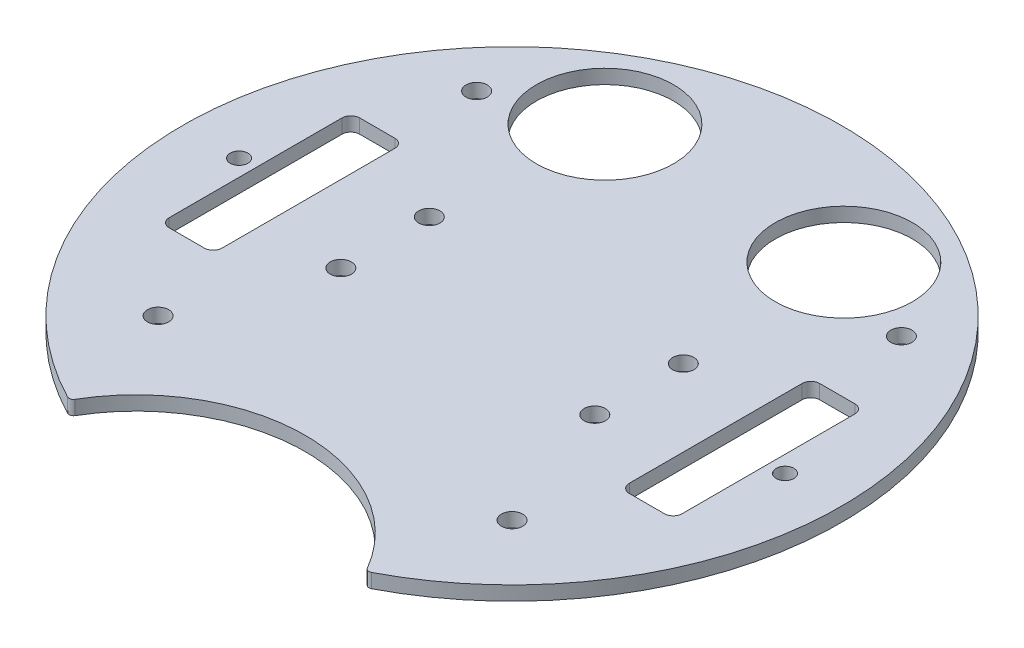
from build123d import *

# Parameters (mm, degrees)
BOSS_EXTRUDE1_DEPTH = 3.2
SKETCH2_W           = 10.76
SKETCH2_H           = 41.868700306
CUT_EXTRUDE1_DEPTH  = 106.40749499
SKETCH3_R           = 2
SKETCH3_R_2         = 2.4
CUT_EXTRUDE2_DEPTH  = 106.40749499
SKETCH4_R           = 15
CUT_EXTRUDE3_DEPTH  = 106.40749499
CUT_EXTRUDE4_DEPTH  = 106.40749499
SKETCH6_R           = 2.4
CUT_EXTRUDE5_DEPTH  = 106.40749499
SKETCH8_R           = 15.5
CUT_EXTRUDE6_DEPTH  = 106.40749499


with BuildPart() as part:
    # Sketch1 → Boss-Extrude1 (new body)
    with BuildSketch(Plane(origin=(0, 0, 0), x_dir=(1, 0, 0), z_dir=(0, 1, 0))):
        with BuildLine():
            ThreePointArc((34.36030176, -66.103098739), (0, 74.5), (-34.36030176, -66.103098739))
            ThreePointArc((-34.36030176, -66.103098739), (-33.621222066, -66.176428208), (-33.035418582, -65.71986465))
            ThreePointArc((-33.035418582, -65.71986465), (0, -46.75), (33.035418582, -65.71986465))
            ThreePointArc((33.035418582, -65.71986465), (33.621222066, -66.176428208), (34.36030176, -66.103098739))
        make_face()
    extrude(amount=BOSS_EXTRUDE1_DEPTH)

    # Sketch2 → Cut-Extrude1 (cut, through all)
    with BuildSketch(Plane(origin=(0, 3.2, 0), x_dir=(1, 0, 0), z_dir=(0, 1, 0))):
        with Locations((-51.99, 0)):
            Rectangle(SKETCH2_W, SKETCH2_H)
        with Locations((51.99, 0)):
            Rectangle(SKETCH2_W, SKETCH2_H)
    extrude(amount=-CUT_EXTRUDE1_DEPTH, mode=Mode.SUBTRACT)

    # Sketch3 → Cut-Extrude2 (cut, through all)
    with BuildSketch(Plane.XZ):
        with Locations((-61.7, 0)):
            Circle(SKETCH3_R)
        with Locations((-28.700738686, 10)):
            Circle(SKETCH3_R_2)
        with Locations((-28.700738686, -10)):
            Circle(SKETCH3_R_2)
        with Locations((28.700738686, -10)):
            Circle(SKETCH3_R_2)
        with Locations((28.700738686, 10)):
            Circle(SKETCH3_R_2)
        with Locations((61.7, 0)):
            Circle(SKETCH3_R)
    extrude(amount=-CUT_EXTRUDE2_DEPTH, mode=Mode.SUBTRACT)

    # Sketch4 → Cut-Extrude3 (cut, through all)
    with BuildSketch(Plane(origin=(0, 3.2, 0), x_dir=(1, 0, 0), z_dir=(0, 1, 0))):
        with Locations((-27, 48)):
            Circle(SKETCH4_R)
        with Locations((27, 48)):
            Circle(SKETCH4_R)
    extrude(amount=-CUT_EXTRUDE3_DEPTH, mode=Mode.SUBTRACT)

    # Sketch5 → Cut-Extrude4 (cut, through all)
    with BuildSketch(Plane(origin=(0, 3.2, 0), x_dir=(1, 0, 0), z_dir=(0, 1, 0))):
        with BuildLine():
            Line((-55.955786438, 21.520136591), (-48.024213562, 21.520136591))
            ThreePointArc((-48.024213562, 21.520136591), (-46.61, 20.934350153), (-46.024213562, 19.520136591))
            Line((-46.024213562, 19.520136591), (-46.024213562, -19.520136591))
            ThreePointArc((-46.024213562, -19.520136591), (-46.61, -20.934350153), (-48.024213562, -21.520136591))
            Line((-48.024213562, -21.520136591), (-55.955786438, -21.520136591))
            ThreePointArc((-55.955786438, -21.520136591), (-57.37, -20.934350153), (-57.955786438, -19.520136591))
            Line((-57.955786438, -19.520136591), (-57.955786438, 19.520136591))
            ThreePointArc((-57.955786438, 19.520136591), (-57.37, 20.934350153), (-55.955786438, 21.520136591))
        make_face()
        with BuildLine():
            Line((46.024213562, 19.520136591), (46.024213562, -19.520136591))
            ThreePointArc((46.024213562, -19.520136591), (46.61, -20.934350153), (48.024213562, -21.520136591))
            Line((48.024213562, -21.520136591), (55.955786438, -21.520136591))
            ThreePointArc((55.955786438, -21.520136591), (57.37, -20.934350153), (57.955786438, -19.520136591))
            Line((57.955786438, -19.520136591), (57.955786438, 19.520136591))
            ThreePointArc((57.955786438, 19.520136591), (57.37, 20.934350153), (55.955786438, 21.520136591))
            Line((55.955786438, 21.520136591), (48.024213562, 21.520136591))
            ThreePointArc((48.024213562, 21.520136591), (46.61, 20.934350153), (46.024213562, 19.520136591))
        make_face()
    extrude(amount=-CUT_EXTRUDE4_DEPTH, mode=Mode.SUBTRACT)

    # Sketch6 → Cut-Extrude5 (cut, through all)
    with BuildSketch(Plane(origin=(0, 3.2, 0), x_dir=(1, 0, 0), z_dir=(0, 1, 0))):
        with Locations((48, 40)):
            Circle(SKETCH6_R)
        with Locations((-40, -40)):
            Circle(SKETCH6_R)
        with Locations((40, -40)):
            Circle(SKETCH6_R)
        with Locations((-48, 40)):
            Circle(SKETCH6_R)
    extrude(amount=-CUT_EXTRUDE5_DEPTH, mode=Mode.SUBTRACT)

    # Sketch8 → Cut-Extrude6 (cut, through all)
    with BuildSketch(Plane(origin=(0, 3.2, 0), x_dir=(1, 0, 0), z_dir=(0, 1, 0))):
        with Locations((-27, 48)):
            Circle(SKETCH8_R)
        with Locations((27, 48)):
            Circle(SKETCH8_R)
    extrude(amount=-CUT_EXTRUDE6_DEPTH, mode=Mode.SUBTRACT)


solid = part.part
